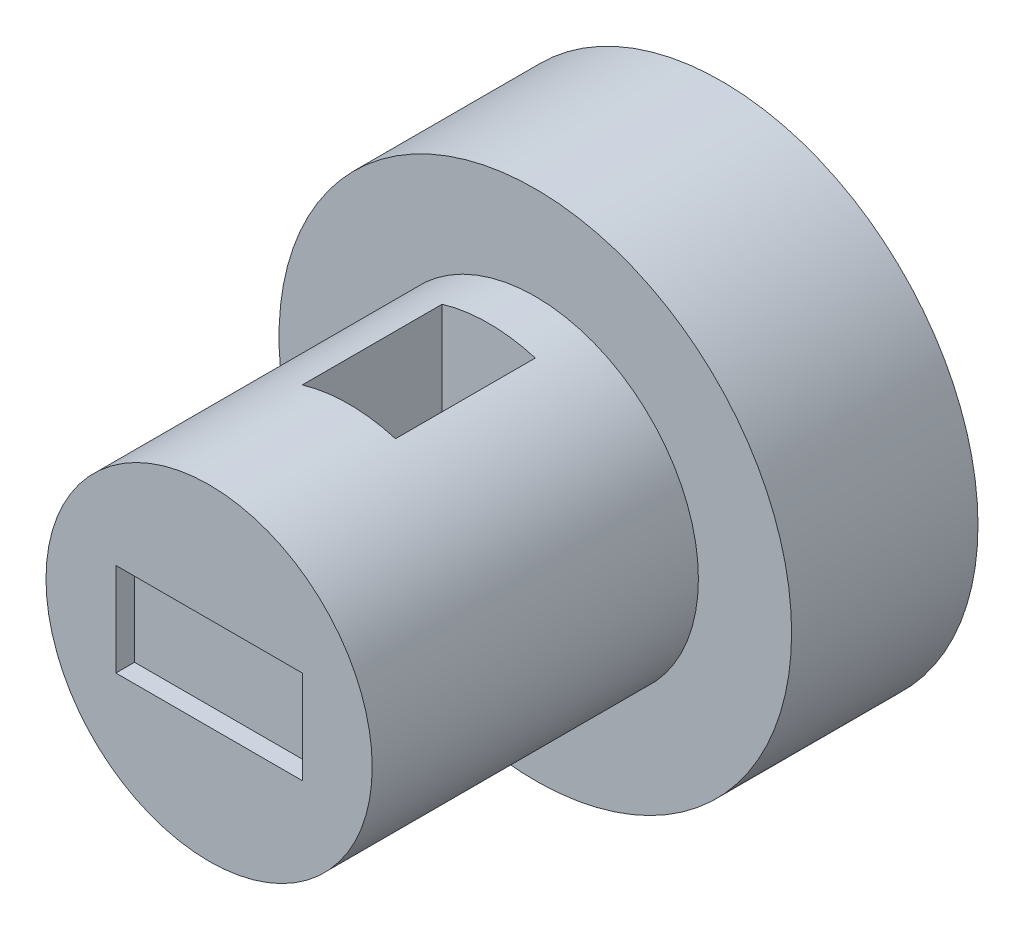
from build123d import *

# Parameters (mm, degrees)
SKETCH_1_R          = 27.5
EXTRUDE_1_DEPTH     = 20
SKETCH_2_R          = 20
CUT_EXTRUDE_1_DEPTH = 15
EXTRUDE_START       = 20
SKETCH_3_R          = 17.5
EXTRUDE_2_DEPTH     = 35
CUT_EXTRUDE_START   = 20
SKETCH_4_W          = 10
SKETCH_4_H          = 15
CUT_EXTRUDE_2_DEPTH = 40
SKETCH_5_W          = 20
SKETCH_5_H          = 10
CUT_EXTRUDE_3_DEPTH = 2


with BuildPart() as part:
    # Эскиз1 → Бобышка-Вытянуть1 (new body)
    with BuildSketch(Plane.XY):
        Circle(SKETCH_1_R)
    extrude(amount=EXTRUDE_1_DEPTH)

    # Эскиз2 → Вырез-Вытянуть1 (cut)
    with BuildSketch(Plane.XY):
        Circle(SKETCH_2_R)
    extrude(amount=CUT_EXTRUDE_1_DEPTH, mode=Mode.SUBTRACT)

    # Эскиз3 → Бобышка-Вытянуть2 (add)
    with BuildSketch(Plane.XY.offset(EXTRUDE_START)):
        Circle(SKETCH_3_R)
    extrude(amount=EXTRUDE_2_DEPTH)

    # Эскиз4 → Вырез-Вытянуть2 (cut)
    with BuildSketch(Plane(origin=(0, 0, 0), x_dir=(1, 0, 0), z_dir=(0, 1, 0)).offset(CUT_EXTRUDE_START)):
        with Locations((0, -32.5)):
            Rectangle(SKETCH_4_W, SKETCH_4_H)
    extrude(amount=-CUT_EXTRUDE_2_DEPTH, mode=Mode.SUBTRACT)

    # Эскиз5 → Вырез-Вытянуть3 (cut)
    with BuildSketch(Plane.XY.offset(55)):
        Rectangle(SKETCH_5_W, SKETCH_5_H)
    extrude(amount=-CUT_EXTRUDE_3_DEPTH, mode=Mode.SUBTRACT)


solid = part.part
